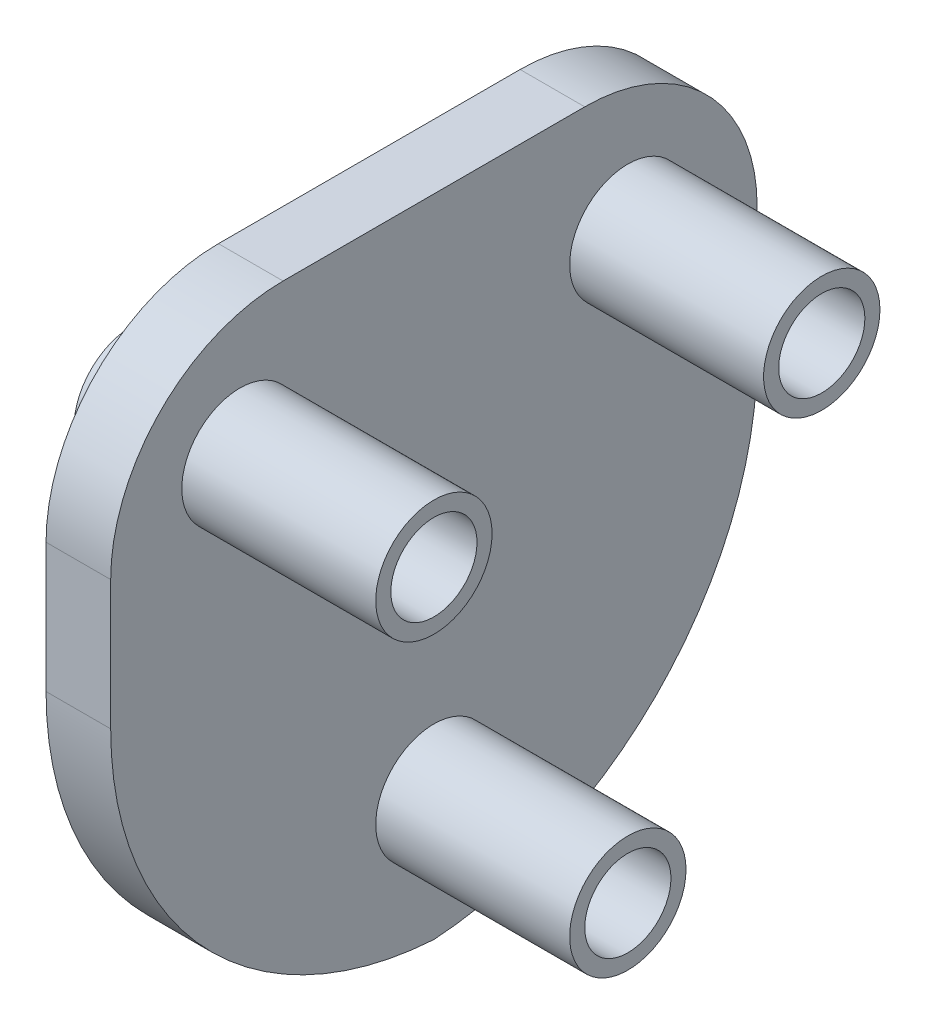
from build123d import *

# Parameters (mm, degrees)
BOSS_EXTRUDE1_DEPTH      = 75
BOSS_EXTRUDE1_DEPTH_BACK = 75
SKETCH1_W                = 15
SKETCH1_H                = 150
BOSS_EXTRUDE2_DEPTH      = 45
BOSS_EXTRUDE2_DEPTH_BACK = 25
SKETCH2_R                = 13.5
F_20_0MM_DOWEL_HOLE1_D   = 20
FILLET2_R                = 80
FILLET3_R                = 40


with BuildPart() as part:
    # Sketch1 → Boss-Extrude1 (new, two sides: drawn at the far end of the back side and taken through both)
    with BuildSketch(Plane.XY.offset(-BOSS_EXTRUDE1_DEPTH_BACK)):
        Rectangle(SKETCH1_W, SKETCH1_H)
    extrude(amount=BOSS_EXTRUDE1_DEPTH + BOSS_EXTRUDE1_DEPTH_BACK)

    # Sketch2 → Boss-Extrude2 (add, two sides: drawn at the far end of the back side and taken through both)
    with BuildSketch(Plane(origin=(7.5, 0, 0), x_dir=(0, 0, -1), z_dir=(1, 0, 0)).offset(-BOSS_EXTRUDE2_DEPTH_BACK)):
        with Locations((0, -45)):
            Circle(SKETCH2_R)
        with Locations((-45, 45)):
            Circle(SKETCH2_R)
        with Locations((45, 45)):
            Circle(SKETCH2_R)
    extrude(amount=BOSS_EXTRUDE2_DEPTH + BOSS_EXTRUDE2_DEPTH_BACK)

    # Ø20.0mm Dowel Hole1 (through all)
    with Locations(Plane(origin=(52.5, 0, 0), x_dir=(0, 0, -1), z_dir=(1, 0, 0))):
        with Locations((-45, 45), (45, 45), (0, -45)):
            Hole(F_20_0MM_DOWEL_HOLE1_D / 2)

    # Fillet2
    # the kernel refuses this fillet: 80 mm, written as the material it takes off along each edge
    with BuildSketch(Plane(origin=(207.5, -75, -75), x_dir=(0, 0, 1), z_dir=(-1, 0, 0))) as fillet2_piece_1:
        with BuildLine():
            CenterArc((FILLET2_R, FILLET2_R), FILLET2_R, 180, 90)
            Line((0, FILLET2_R), (0, 0))
            Line((0, 0), (FILLET2_R, 0))
        make_face()
    extrude(amount=415, mode=Mode.SUBTRACT)
    with BuildSketch(Plane(origin=(207.5, -75, 75), x_dir=(0, 0, -1), z_dir=(-1, 0, 0))) as fillet2_piece_2:
        with BuildLine():
            CenterArc((FILLET2_R, -FILLET2_R), FILLET2_R, 90, 90)
            Line((0, -FILLET2_R), (0, 0))
            Line((0, 0), (FILLET2_R, 0))
        make_face()
    extrude(amount=415, mode=Mode.SUBTRACT)

    # Fillet3
    fillet3_edges = [part.edges().sort_by_distance(p)[0] for p in [
        (0, 75, 75),
        (0, 75, -75),
    ]]
    fillet(fillet3_edges, radius=FILLET3_R)


solid = part.part
